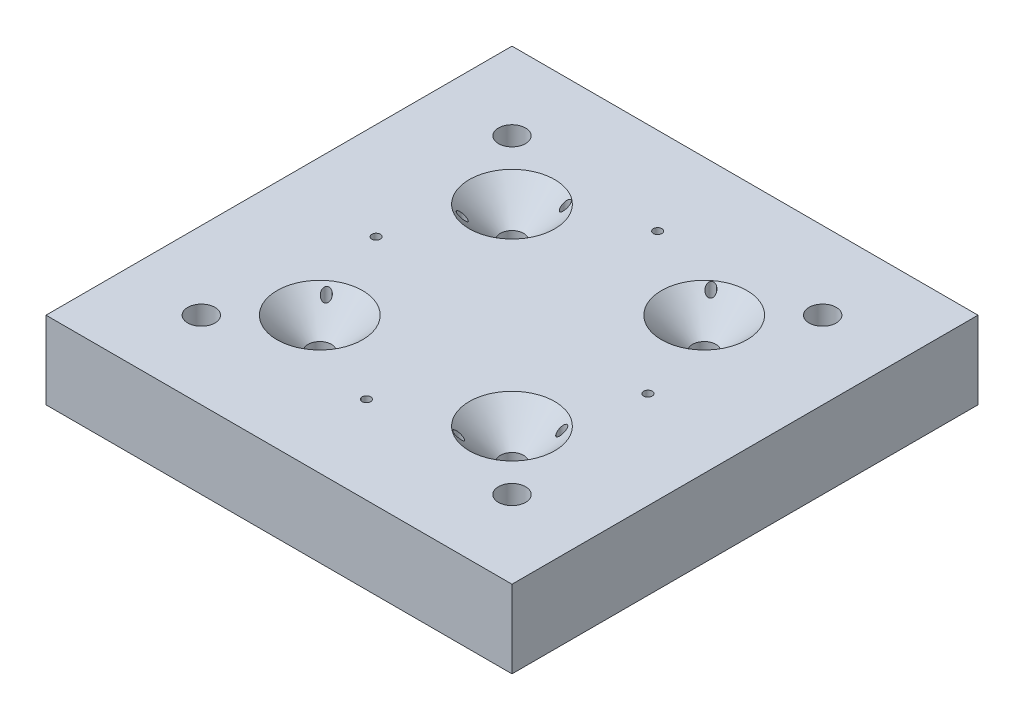
from build123d import *

# Parameters (mm, degrees)
SKETCH16_W          = 60
SKETCH16_H          = 60
BOSS_EXTRUDE7_DEPTH = 10
REVOLVE3_ANGLE      = 180
SKETCH18_R          = 1.75
CUT_EXTRUDE1_DEPTH  = 20.5
SKETCH19_R          = 1.5
CUT_EXTRUDE2_DEPTH  = 10
CIRPATTERN1_COUNT   = 4
CHAMFER1_SIZE       = 4
SKETCH24_R          = 0.55
CUT_EXTRUDE3_DEPTH  = 47
SKETCH30_R          = 0.55
CUT_EXTRUDE4_DEPTH  = 46
SKETCH32_R          = 0.55
CUT_EXTRUDE6_DEPTH  = 46
SKETCH35_W          = 37.108936952
SKETCH35_H          = 20.335438399
CUT_EXTRUDE7_DEPTH  = 66
SKETCH40_R          = 15
CUT_EXTRUDE8_DEPTH  = 3
SKETCH41_W          = 3
SKETCH41_H          = 3


with BuildPart() as part:
    # Sketch16 → Boss-Extrude7 (new body)
    with BuildSketch(Plane(origin=(0, 57.950548418, 0), x_dir=(1, 0, 0), z_dir=(0, 1, 0))):
        Rectangle(SKETCH16_W, SKETCH16_H)
    extrude(amount=BOSS_EXTRUDE7_DEPTH)

    # Sketch17 → Revolve3 (revolve)
    with BuildSketch(Plane.XZ.offset(-57.950548418)):
        with BuildLine():
            Line((0, 15), (0, -15))
            ThreePointArc((0, -15), (15, 0), (0, 15))
        make_face()
    revolve(axis=Axis((0, 57.950548418, 15), (0, 0, -1)), revolution_arc=REVOLVE3_ANGLE)

    # Sketch18 → Cut-Extrude1 (cut, symmetric)
    with BuildSketch(Plane.XZ.offset(-57.950548418)):
        with Locations((-20, 20)):
            Circle(SKETCH18_R)
        with Locations((20, 20)):
            Circle(SKETCH18_R)
        with Locations((-20, -20)):
            Circle(SKETCH18_R)
        with Locations((20, -20)):
            Circle(SKETCH18_R)
    extrude(amount=CUT_EXTRUDE1_DEPTH, both=True, mode=Mode.SUBTRACT)

    # Sketch19 → Cut-Extrude2 (cut)
    with BuildSketch(Plane(origin=(0, 67.950548418, 0), x_dir=(1, 0, 0), z_dir=(0, 1, 0))):
        with Locations((12.374368671, 12.374368671)):
            Circle(SKETCH19_R)
    cut_extrude2 = extrude(amount=-CUT_EXTRUDE2_DEPTH, mode=Mode.SUBTRACT)

    # CirPattern1: Cut-Extrude2 ×4 about axis
    cirpattern1_axis = Axis((0, 57.950548418, 0), (0, -1, 0))
    for i in range(1, CIRPATTERN1_COUNT):
        add(cut_extrude2.rotate(cirpattern1_axis, i * 360 / CIRPATTERN1_COUNT), mode=Mode.SUBTRACT)

    # Chamfer1
    chamfer1_edges = [part.edges().sort_by_distance(p)[0] for p in [
        (-12.374368671, 67.950548418, -10.874368671),
        (10.874368671, 67.950548418, -12.374368671),
        (12.374368671, 67.950548418, 10.874368671),
        (-10.874368671, 67.950548418, 12.374368671),
    ]]
    chamfer(chamfer1_edges, length=CHAMFER1_SIZE)

    # Sketch24 → Cut-Extrude3 (cut)
    with BuildSketch(Plane(origin=(0, 67.950548418, 0), x_dir=(1, 0, 0), z_dir=(0, 1, 0))):
        with Locations((-17.5, 0)):
            Circle(SKETCH24_R)
        with Locations((17.5, 0)):
            Circle(SKETCH24_R)
    extrude(amount=-CUT_EXTRUDE3_DEPTH, mode=Mode.SUBTRACT)

    # Sketch30 → Cut-Extrude4 (cut, through all)
    with BuildSketch(Plane.XZ.offset(-57.950548418)):
        with Locations((-15.155444566, 8.75)):
            Circle(SKETCH30_R)
        with Locations((15.155444566, 8.75)):
            Circle(SKETCH30_R)
        with Locations((15.155444566, -8.75)):
            Circle(SKETCH30_R)
        with Locations((-15.155444566, -8.75)):
            Circle(SKETCH30_R)
    extrude(amount=-CUT_EXTRUDE4_DEPTH, mode=Mode.SUBTRACT)

    # Sketch32 → Cut-Extrude6 (cut, through all)
    with BuildSketch(Plane.XZ.offset(-57.950548418)):
        with Locations((0, 18.75)):
            Circle(SKETCH32_R)
        with Locations((9.375, 16.237976321)):
            Circle(SKETCH32_R)
        with Locations((9.375, -16.237976321)):
            Circle(SKETCH32_R)
        with Locations((0, -18.75)):
            Circle(SKETCH32_R)
        with Locations((-9.375, -16.237976321)):
            Circle(SKETCH32_R)
        with Locations((-9.375, 16.237976321)):
            Circle(SKETCH32_R)
    extrude(amount=-CUT_EXTRUDE6_DEPTH, mode=Mode.SUBTRACT)

    # Sketch35 → Cut-Extrude7 (cut)
    with BuildSketch(Plane(origin=(0, 0, -30), x_dir=(-1, 0, 0), z_dir=(0, 0, -1))):
        with Locations((-0.194287628, 37.782829219)):
            Rectangle(SKETCH35_W, SKETCH35_H)
    extrude(amount=-CUT_EXTRUDE7_DEPTH, mode=Mode.SUBTRACT)

    # Sketch40 → Cut-Extrude8 (cut)
    with BuildSketch(Plane(origin=(0, 57.950548418, 0), x_dir=(-1, 0, 0), z_dir=(0, -1, 0))):
        with BuildLine():
            ThreePointArc((-24.875, -2.496873044), (-17.67766953, -17.67766953), (-2.496873044, -24.875))
            ThreePointArc((-2.496873044, -24.875), (0, -22.5), (2.496873044, -24.875))
            ThreePointArc((2.496873044, -24.875), (17.67766953, -17.67766953), (24.875, -2.496873044))
            ThreePointArc((24.875, -2.496873044), (22.5, 0), (24.875, 2.496873044))
            ThreePointArc((24.875, 2.496873044), (17.67766953, 17.67766953), (2.496873044, 24.875))
            ThreePointArc((2.496873044, 24.875), (0, 22.5), (-2.496873044, 24.875))
            ThreePointArc((-2.496873044, 24.875), (-17.67766953, 17.67766953), (-24.875, 2.496873044))
            ThreePointArc((-24.875, 2.496873044), (-22.5, 0), (-24.875, -2.496873044))
        make_face()
        Circle(SKETCH40_R, mode=Mode.SUBTRACT)
    extrude(amount=-CUT_EXTRUDE8_DEPTH, mode=Mode.SUBTRACT)

    # Sketch41 → Cut-Revolve1 (revolve, cut)
    with BuildSketch(Plane.XY):
        with Locations((13.5, 59.450548418)):
            Rectangle(SKETCH41_W, SKETCH41_H)
    revolve(axis=Axis((0, 67.950548418, 0), (0, -1, 0)), mode=Mode.SUBTRACT)


solid = part.part
